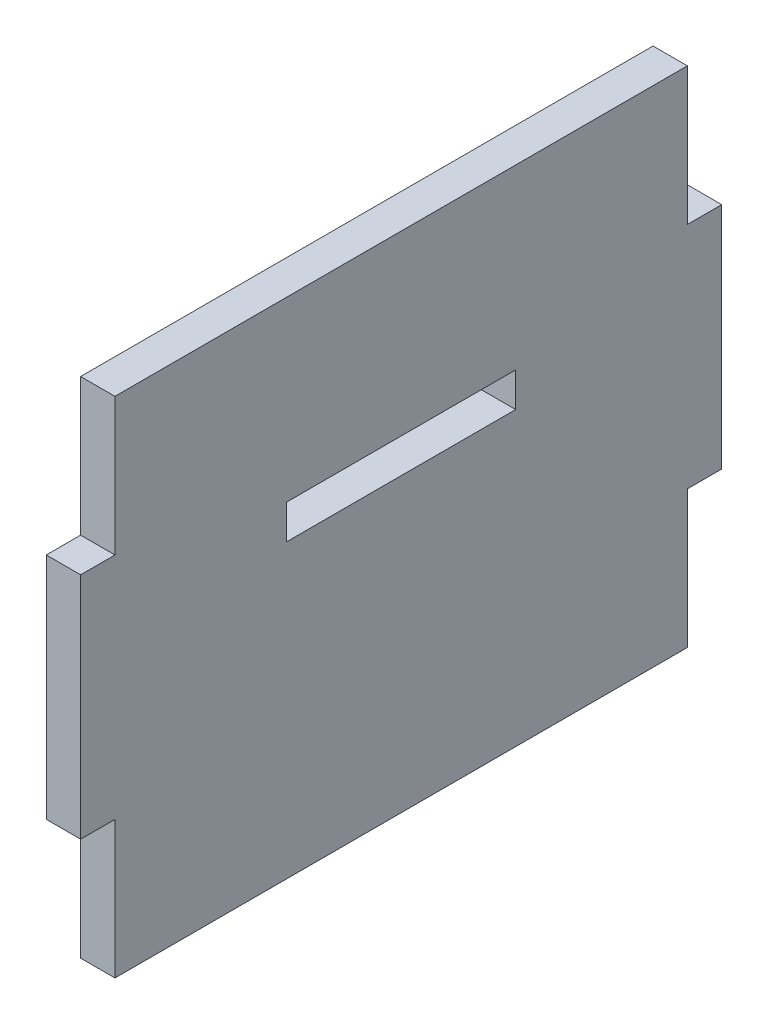
from build123d import *

# Parameters (mm, degrees)
SKETCH1_W           = 20
SKETCH1_H           = 3
BOSS_EXTRUDE1_DEPTH = 3


with BuildPart() as part:
    # Sketch1 → Boss-Extrude1 (new body)
    with BuildSketch(Plane(origin=(0, 0, 0), x_dir=(0, 0, -1), z_dir=(1, 0, 0))):
        Polygon((0, 0), (50, 0), (50, 12), (53, 12), (53, 32), (50, 32), (50, 44), (0, 44), (0, 32), (-3, 32), (-3, 12), (0, 12), align=None)
        with Locations((25, 27)):
            Rectangle(SKETCH1_W, SKETCH1_H, mode=Mode.SUBTRACT)
    extrude(amount=BOSS_EXTRUDE1_DEPTH)


solid = part.part
